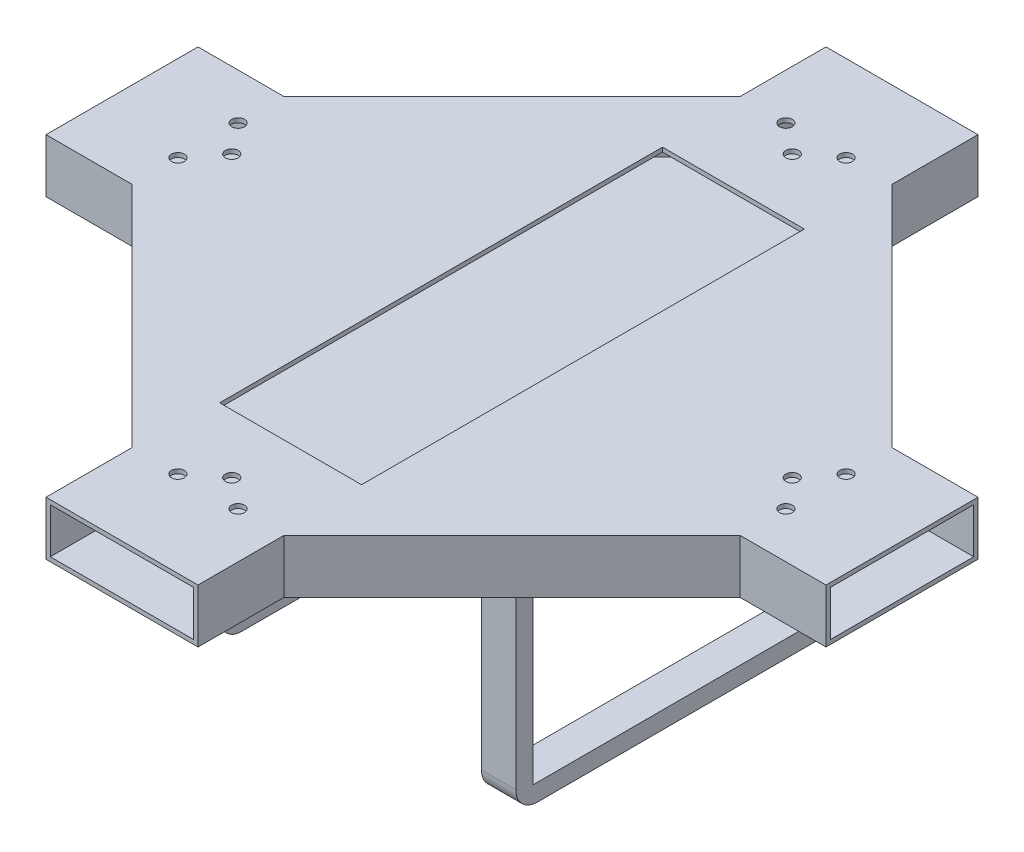
from build123d import *
from build123d.topology import SkipClean

# Parameters (mm, degrees)
BOSS_EXTRUDE1_DEPTH = 12.5
CHAMFER1_SIZE       = 25
SKETCH3_W           = 35.35533906
SKETCH3_H           = 12.5
BOSS_EXTRUDE2_DEPTH = 20
SKETCH4_W           = 35.35533906
SKETCH4_H           = 12.5
BOSS_EXTRUDE3_DEPTH = 20
SKETCH5_W           = 35.35533906
SKETCH5_H           = 12.5
BOSS_EXTRUDE4_DEPTH = 20
SKETCH6_W           = 35.35533906
SKETCH6_H           = 12.5
BOSS_EXTRUDE5_DEPTH = 20
SHELL1_T            = -1
SKETCH7_R           = 1.5
CUT_EXTRUDE1_DEPTH  = 20
CIRPATTERN1_COUNT   = 4
SKETCH8_W           = 8
SKETCH8_H           = 75
BOSS_EXTRUDE6_DEPTH = 50
CUT_EXTRUDE2_REACH  = 167.514
SKETCH9_W           = 67
SKETCH9_H           = 42
FILLET2_START       = -38.388347648
FILLET2_DEPTH       = 8
FILLET2_START_2     = 30.388347648
FILLET2_2_DEPTH     = 8
FILLET2_START_3     = -42.5
FILLET2_3_DEPTH     = 85
FILLET2_START_4     = -44
FILLET2_4_OUTLINE_W = 1
FILLET2_4_OUTLINE_H = 67
FILLET2_4_DEPTH     = 88
FILLET3_R           = 5
CUT_EXTRUDE3_REACH  = 144.699
SKETCH10_W          = 33
SKETCH10_H          = 103
CUT_EXTRUDE4_START  = -12.5
SKETCH11_R          = 1.5
CUT_EXTRUDE4_DEPTH  = 12.5


with BuildPart() as part:
    # Sketch1 → Boss-Extrude1 (new body)
    with BuildSketch(Plane(origin=(0, 0, 0), x_dir=(1, 0, 0), z_dir=(0, 1, 0))):
        Polygon((88.388347648, 0), (0, 88.388347648), (-88.388347648, 0), (0, -88.388347648), align=None)
    extrude(amount=BOSS_EXTRUDE1_DEPTH)

    # Chamfer1
    chamfer1_edges = [part.edges().sort_by_distance(p)[0] for p in [
        (0, 6.25, 88.388347648),
        (-88.388347648, 6.25, 0),
        (0, 6.25, -88.388347648),
        (88.388347648, 6.25, 0),
    ]]
    chamfer(chamfer1_edges, length=CHAMFER1_SIZE)

    # Sketch3 → Boss-Extrude2 (add)
    with BuildSketch(Plane.XY.offset(70.710678119)):
        with Locations((0, 6.25)):
            Rectangle(SKETCH3_W, SKETCH3_H)
    extrude(amount=BOSS_EXTRUDE2_DEPTH)

    # Sketch4 → Boss-Extrude3 (add)
    with BuildSketch(Plane(origin=(70.710678119, 0, 0), x_dir=(0, 0, -1), z_dir=(1, 0, 0))):
        with Locations((0, 6.25)):
            Rectangle(SKETCH4_W, SKETCH4_H)
    extrude(amount=BOSS_EXTRUDE3_DEPTH)

    # Sketch5 → Boss-Extrude4 (add)
    with BuildSketch(Plane(origin=(0, 0, -70.710678119), x_dir=(-1, 0, 0), z_dir=(0, 0, -1))):
        with Locations((0, 6.25)):
            Rectangle(SKETCH5_W, SKETCH5_H)
    extrude(amount=BOSS_EXTRUDE4_DEPTH)

    # Sketch6 → Boss-Extrude5 (add)
    with BuildSketch(Plane.ZY.offset(70.710678119)):
        with Locations((0, 6.25)):
            Rectangle(SKETCH6_W, SKETCH6_H)
    extrude(amount=BOSS_EXTRUDE5_DEPTH)

    # Shell1
    shell1_openings = [part.faces().sort_by_distance(p)[0] for p in [
        (0, 6.25, 90.710678119),
        (90.710678119, 6.25, 0),
        (0, 6.25, -90.710678119),
        (-90.710678119, 6.25, 0),
    ]]
    offset(amount=SHELL1_T, openings=shell1_openings, kind=Kind.INTERSECTION)

    # Sketch7 → Cut-Extrude1 (cut)
    with BuildSketch(Plane(origin=(-70.710678119, 0, -17.67766953), x_dir=(1, 0, 0), z_dir=(0, 1, 0))):
        with Locations(Location((63.710678119, -88.388347648, 0), (0, 0, 270))):
            Circle(SKETCH7_R)
        with Locations(Location((77.710678119, -88.388347648, 0), (0, 0, 270))):
            Circle(SKETCH7_R)
    cut_extrude1 = extrude(amount=CUT_EXTRUDE1_DEPTH, mode=Mode.SUBTRACT)

    # CirPattern1: Cut-Extrude1 ×4 about axis
    cirpattern1_axis = Axis((0, 0, 0), (0, 1, 0))
    for i in range(1, CIRPATTERN1_COUNT):
        add(cut_extrude1.rotate(cirpattern1_axis, i * 360 / CIRPATTERN1_COUNT), mode=Mode.SUBTRACT)

    # Sketch8 → Boss-Extrude6 (add)
    with BuildSketch(Plane.XZ):
        with Locations((-34.388347648, 0)):
            Rectangle(SKETCH8_W, SKETCH8_H)
        with Locations((34.388347648, 0)):
            Rectangle(SKETCH8_W, SKETCH8_H)
    extrude(amount=BOSS_EXTRUDE6_DEPTH)

    # Cut-Extrude2: up to this face of the body (flat: up to its plane)
    cut_extrude2_end = Plane(part.part.faces().sort_by_distance((-38.388347648, -25, 0))[0])
    # Sketch9 → Cut-Extrude2 (cut, up to the picked face)
    with BuildSketch(Plane(origin=(38.388347648, 0, 0), x_dir=(0, 0, -1), z_dir=(1, 0, 0)), mode=Mode.PRIVATE) as cut_extrude2_sk1:
        with Locations((0, -25)):
            Rectangle(SKETCH9_W, SKETCH9_H)
    cut_extrude2_tool1 = split(extrude(cut_extrude2_sk1.sketch, amount=-CUT_EXTRUDE2_REACH, mode=Mode.PRIVATE), bisect_by=cut_extrude2_end, keep=Keep.BOTH, mode=Mode.PRIVATE)
    add(cut_extrude2_tool1.solids().sort_by(Axis((38.388348, -25, 0), (-1, 0, 0)))[0], mode=Mode.SUBTRACT)

    # Fillet2: read off the stored shape, not the designer's step
    # Fillet2 outline → Fillet2 (add)
    with BuildSketch(Plane.YZ.offset(FILLET2_START)):
        with BuildLine():
            Line((0, -42.5), (0, -37.5))
            Line((0, -37.5), (-5, -37.5))
            ThreePointArc((-5, -37.5), (-1.464466094, -38.964466094), (0, -42.5))
        make_face()
        with BuildLine():
            ThreePointArc((0, 42.5), (-1.464466094, 38.964466094), (-5, 37.5))
            Line((-5, 37.5), (0, 37.5))
            Line((0, 37.5), (0, 42.5))
        make_face()
    extrude(amount=FILLET2_DEPTH)

    # Fillet2 2 outline → Fillet2 2 (add)
    with BuildSketch(Plane.YZ.offset(FILLET2_START_2)):
        with BuildLine():
            Line((0, -42.5), (0, -37.5))
            Line((0, -37.5), (-5, -37.5))
            ThreePointArc((-5, -37.5), (-1.464466094, -38.964466094), (0, -42.5))
        make_face()
        with BuildLine():
            ThreePointArc((0, 42.5), (-1.464466094, 38.964466094), (-5, 37.5))
            Line((-5, 37.5), (0, 37.5))
            Line((0, 37.5), (0, 42.5))
        make_face()
    extrude(amount=FILLET2_2_DEPTH)

    # Fillet2 3 outline → Fillet2 3 (add)
    with BuildSketch(Plane.XY.offset(FILLET2_START_3)):
        with BuildLine():
            Line((-38.388347648, -5), (-38.388347648, 0))
            Line((-38.388347648, 0), (-43.388347648, 0))
            ThreePointArc((-43.388347648, 0), (-39.852813742, -1.464466094), (-38.388347648, -5))
        make_face()
        with BuildLine():
            ThreePointArc((-30.388347648, -5), (-28.923881554, -1.464466094), (-25.388347648, 0))
            Line((-25.388347648, 0), (-30.388347648, 0))
            Line((-30.388347648, 0), (-30.388347648, -5))
        make_face()
        with BuildLine():
            Line((43.388347648, 0), (38.388347648, 0))
            Line((38.388347648, 0), (38.388347648, -5))
            ThreePointArc((38.388347648, -5), (39.852813742, -1.464466094), (43.388347648, 0))
        make_face()
        with BuildLine():
            ThreePointArc((25.388347648, 0), (28.923881554, -1.464466094), (30.388347648, -5))
            Line((30.388347648, -5), (30.388347648, 0))
            Line((30.388347648, 0), (25.388347648, 0))
        make_face()
    extrude(amount=FILLET2_3_DEPTH)

    # Fillet2 4 outline → Fillet2 4 (cut)
    with SkipClean():  # the faces are left unmerged after this step: merging them gives an invalid solid
        with BuildSketch(Plane.YZ.offset(FILLET2_START_4)):
            with BuildLine():
                Line((-5, 42.5), (-5, 37.5))
                ThreePointArc((-5, 37.5), (-1.464466094, 38.964466094), (0, 42.5))
                Line((0, 42.5), (-5, 42.5))
            make_face()
            with BuildLine():
                Line((-5, -37.5), (-5, -42.5))
                Line((-5, -42.5), (0, -42.5))
                ThreePointArc((0, -42.5), (-1.464466094, -38.964466094), (-5, -37.5))
            make_face()
            with Locations((-4.5, 0)):
                Rectangle(FILLET2_4_OUTLINE_W, FILLET2_4_OUTLINE_H)
        extrude(amount=FILLET2_4_DEPTH, mode=Mode.SUBTRACT)
    add(part.part.scale(1), mode=Mode.REPLACE)  # the faces are merged on a copy

    # Fillet3
    fillet3_edges = [part.edges().sort_by_distance(p)[0] for p in [
        (-34.388347648, -50, -37.5),
        (-34.388347648, -50, 37.5),
        (34.388347648, -50, -37.5),
        (34.388347648, -50, 37.5),
    ]]
    fillet(fillet3_edges, radius=FILLET3_R)

    # Sketch10 → Cut-Extrude3 (cut, up to next)
    with BuildSketch(Plane(origin=(0, 12.5, 0), x_dir=(1, 0, 0), z_dir=(0, 1, 0)), mode=Mode.PRIVATE) as cut_extrude3_sk1:
        Rectangle(SKETCH10_W, SKETCH10_H)
    cut_extrude3_tool1 = extrude(cut_extrude3_sk1.sketch, amount=-CUT_EXTRUDE3_REACH, mode=Mode.PRIVATE) & part.part
    add(cut_extrude3_tool1.solids().sort_by_distance((0, 12.5, 0))[0], mode=Mode.SUBTRACT)

    # Sketch11 → Cut-Extrude4 (cut)
    with BuildSketch(Plane(origin=(0, 12.5, 0), x_dir=(1, 0, 0), z_dir=(0, 1, 0)).offset(CUT_EXTRUDE4_START)):
        with Locations(Location((0, -65.181873268, 0), (0, 0, 270))):
            Circle(SKETCH11_R)
        with Locations(Location((-65.181873268, 0, 0), (0, 0, 270))):
            Circle(SKETCH11_R)
        with Locations(Location((0, 65.181873268, 0), (0, 0, 270))):
            Circle(SKETCH11_R)
        with Locations(Location((65.181873268, 0, 0), (0, 0, 270))):
            Circle(SKETCH11_R)
    extrude(amount=CUT_EXTRUDE4_DEPTH, mode=Mode.SUBTRACT)


solid = part.part
